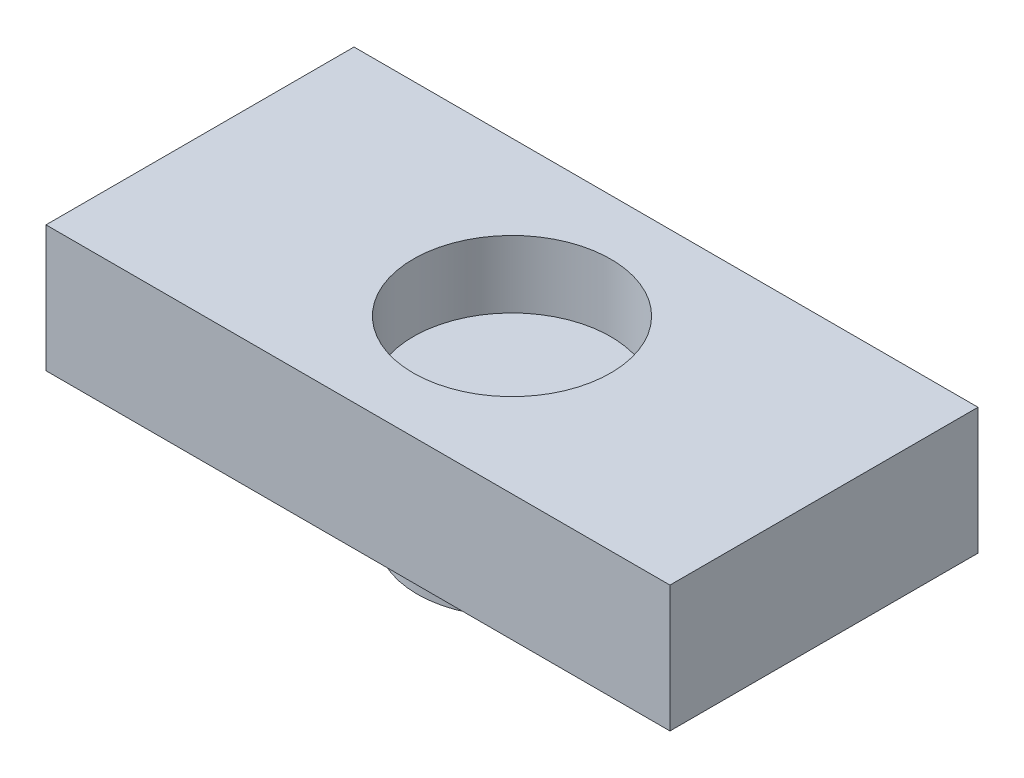
from build123d import *

# Parameters (mm, degrees)
SKETCH_1_W          = 15.8
SKETCH_1_H          = 7.8
EXTRUDE_1_DEPTH     = 3.2
SKETCH_2_R          = 2.4
SKETCH_2_R_2        = 1.6
EXTRUDE_2_DEPTH     = 1.7
SKETCH_4_R          = 2.5
CUT_EXTRUDE_3_DEPTH = 1.7


with BuildPart() as part:
    # Эскиз1 → Бобышка-Вытянуть1 (new body)
    with BuildSketch(Plane(origin=(0, 0, 0), x_dir=(1, 0, 0), z_dir=(0, 1, 0))):
        Rectangle(SKETCH_1_W, SKETCH_1_H)
    extrude(amount=EXTRUDE_1_DEPTH)

    # Эскиз2 → Бобышка-Вытянуть2 (add)
    with BuildSketch(Plane(origin=(0, 0, 0), x_dir=(1, 0, 0), z_dir=(0, 1, 0))):
        Circle(SKETCH_2_R)
        Circle(SKETCH_2_R_2, mode=Mode.SUBTRACT)
    extrude(amount=-EXTRUDE_2_DEPTH)

    # Эскиз4 → Вырез-Вытянуть3 (cut)
    with BuildSketch(Plane(origin=(0, 3.2, 0), x_dir=(1, 0, 0), z_dir=(0, 1, 0))):
        Circle(SKETCH_4_R)
    extrude(amount=-CUT_EXTRUDE_3_DEPTH, mode=Mode.SUBTRACT)


solid = part.part
